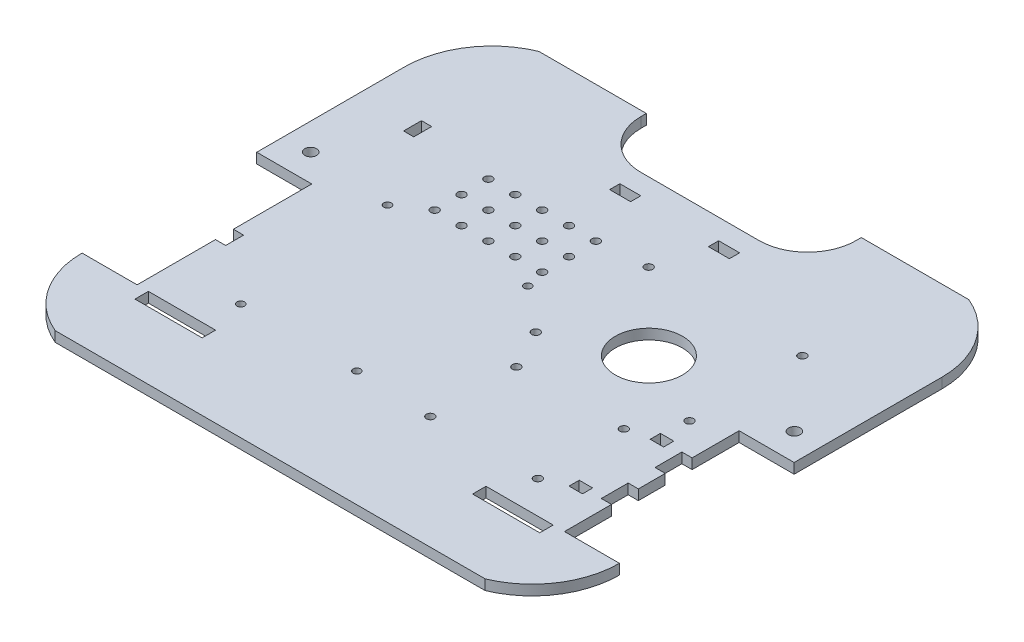
from build123d import *

# Parameters (mm, degrees)
SKETCH1_W           = 254
SKETCH1_H           = 228.6
BOSS_EXTRUDE1_DEPTH = 4.826
SKETCH2_W           = 26.00000007
SKETCH2_H           = 82.55
CUT_EXTRUDE1_DEPTH  = 4.826
CUT_EXTRUDE3_DEPTH  = 4.826
SKETCH7_W           = 101.6
SKETCH7_H           = 25.4
CUT_EXTRUDE5_DEPTH  = 4.826
FILLET9_R           = 22.86
FILLET10_R          = 22.86
CUT_EXTRUDE6_DEPTH  = 4.826
SKETCH9_W           = 31.75
SKETCH9_H           = 6.35
CUT_EXTRUDE7_DEPTH  = 171.929167423
SKETCH11_W          = 9.906
SKETCH11_H          = 4.826
CUT_EXTRUDE8_DEPTH  = 171.929167423
SKETCH13_R          = 1.905
CUT_EXTRUDE10_DEPTH = 171.929167423
SKETCH14_R          = 1.778
CUT_EXTRUDE11_DEPTH = 171.929167423
SKETCH15_R          = 1.905
CUT_EXTRUDE12_DEPTH = 171.929167423
SKETCH16_R          = 1.905
CUT_EXTRUDE13_DEPTH = 171.929167423
SKETCH17_R          = 2.778125
CUT_EXTRUDE14_DEPTH = 171.929167423
SKETCH18_W          = 4.826
SKETCH18_H          = 12.7
CUT_EXTRUDE15_DEPTH = 171.929167423
SKETCH19_W          = 4.826
SKETCH19_H          = 8.466666666
CUT_EXTRUDE16_DEPTH = 171.929167423
SKETCH20_W          = 6.35
SKETCH20_H          = 4.826
CUT_EXTRUDE17_DEPTH = 4.826
SKETCH21_R          = 15.875
CUT_EXTRUDE18_DEPTH = 171.929167423


with BuildPart() as part:
    # Sketch1 → Boss-Extrude1 (new body)
    with BuildSketch(Plane(origin=(0, 0, 0), x_dir=(1, 0, 0), z_dir=(0, 1, 0))):
        Rectangle(SKETCH1_W, SKETCH1_H)
    extrude(amount=BOSS_EXTRUDE1_DEPTH)

    # Sketch2 → Cut-Extrude1 (cut)
    with BuildSketch(Plane(origin=(0, 4.826, 0), x_dir=(1, 0, 0), z_dir=(0, 1, 0))):
        with Locations((-113.999999965, -34.925)):
            Rectangle(SKETCH2_W, SKETCH2_H)
        with Locations((113.999999965, -34.925)):
            Rectangle(SKETCH2_W, SKETCH2_H)
    extrude(amount=-CUT_EXTRUDE1_DEPTH, mode=Mode.SUBTRACT)

    # Sketch4 → Cut-Extrude3 (cut)
    with BuildSketch(Plane(origin=(0, 4.826, 0), x_dir=(1, 0, 0), z_dir=(0, 1, 0))):
        with BuildLine():
            Line((-127, 76.2), (-127, 114.3))
            Line((-127, 114.3), (-101.6, 114.3))
            ThreePointArc((-101.6, 114.3), (-120.067875899, 99.095250599), (-127, 76.2))
        make_face()
        with BuildLine():
            Line((127, 76.2), (127, 114.3))
            Line((127, 114.3), (101.6, 114.3))
            ThreePointArc((101.6, 114.3), (120.067875899, 99.095250599), (127, 76.2))
        make_face()
    extrude(amount=-CUT_EXTRUDE3_DEPTH, mode=Mode.SUBTRACT)

    # Sketch7 → Cut-Extrude5 (cut)
    with BuildSketch(Plane(origin=(0, 4.826, 0), x_dir=(1, 0, 0), z_dir=(0, 1, 0))):
        with Locations((0, 101.6)):
            Rectangle(SKETCH7_W, SKETCH7_H)
    extrude(amount=-CUT_EXTRUDE5_DEPTH, mode=Mode.SUBTRACT)

    # Fillet9
    fillet9_edges = [part.edges().sort_by_distance(p)[0] for p in [
        (-50.8, 2.413, -88.9),
    ]]
    fillet(fillet9_edges, radius=FILLET9_R)

    # Fillet10
    fillet10_edges = [part.edges().sort_by_distance(p)[0] for p in [
        (50.8, 2.413, -88.9),
    ]]
    fillet(fillet10_edges, radius=FILLET10_R)

    # Sketch8 → Cut-Extrude6 (cut)
    with BuildSketch(Plane(origin=(0, 4.826, 0), x_dir=(1, 0, 0), z_dir=(0, 1, 0))):
        with BuildLine():
            Line((-127, -76.2), (-127, -114.3))
            Line((-127, -114.3), (-101.6, -114.3))
            ThreePointArc((-101.6, -114.3), (-120.067875899, -99.095250599), (-127, -76.2))
        make_face()
        with BuildLine():
            Line((127, -114.3), (101.6, -114.3))
            ThreePointArc((101.6, -114.3), (120.067875899, -99.095250599), (127, -76.2))
            Line((127, -76.2), (127, -114.3))
        make_face()
    extrude(amount=-CUT_EXTRUDE6_DEPTH, mode=Mode.SUBTRACT)

    # Sketch9 → Cut-Extrude7 (cut, through all)
    with BuildSketch(Plane.XZ):
        with Locations((-79.79099993, 79.375)):
            Rectangle(SKETCH9_W, SKETCH9_H)
        with Locations((79.79099993, 79.375)):
            Rectangle(SKETCH9_W, SKETCH9_H)
    extrude(amount=-CUT_EXTRUDE7_DEPTH, mode=Mode.SUBTRACT)

    # Sketch11 → Cut-Extrude8 (cut, through all)
    with BuildSketch(Plane(origin=(0, 4.826, 0), x_dir=(1, 0, 0), z_dir=(0, 1, 0))):
        with Locations((-23.345869789, 76.863822677)):
            Rectangle(SKETCH11_W, SKETCH11_H)
        with Locations((23.345869789, 76.863822677)):
            Rectangle(SKETCH11_W, SKETCH11_H)
    extrude(amount=-CUT_EXTRUDE8_DEPTH, mode=Mode.SUBTRACT)

    # Sketch13 → Cut-Extrude10 (cut, through all)
    with BuildSketch(Plane(origin=(0, 4.826, 0), x_dir=(1, 0, 0), z_dir=(0, 1, 0))):
        with Locations((-10.4749371, 24.715879034)):
            Circle(SKETCH13_R)
        with Locations((-23.1749371, 24.715879034)):
            Circle(SKETCH13_R)
        with Locations((-35.8749371, 24.715879034)):
            Circle(SKETCH13_R)
        with Locations((-48.5749371, 24.715879034)):
            Circle(SKETCH13_R)
        with Locations((-61.2749371, 24.715879034)):
            Circle(SKETCH13_R)
        with Locations((-23.1749371, 37.415879034)):
            Circle(SKETCH13_R)
        with Locations((-35.8749371, 37.415879034)):
            Circle(SKETCH13_R)
        with Locations((-48.5749371, 37.415879034)):
            Circle(SKETCH13_R)
        with Locations((-61.2749371, 37.415879034)):
            Circle(SKETCH13_R)
        with Locations((-23.1749371, 50.115879034)):
            Circle(SKETCH13_R)
        with Locations((-35.8749371, 50.115879034)):
            Circle(SKETCH13_R)
        with Locations((-48.5749371, 50.115879034)):
            Circle(SKETCH13_R)
        with Locations((-61.2749371, 50.115879034)):
            Circle(SKETCH13_R)
        with Locations((-10.4749371, 37.415879034)):
            Circle(SKETCH13_R)
        with Locations((-10.4749371, 50.115879034)):
            Circle(SKETCH13_R)
    extrude(amount=-CUT_EXTRUDE10_DEPTH, mode=Mode.SUBTRACT)

    # Sketch14 → Cut-Extrude11 (cut, through all)
    with BuildSketch(Plane(origin=(0, 4.826, 0), x_dir=(1, 0, 0), z_dir=(0, 1, 0))):
        with Locations((-68.6409371, -59.556843517)):
            Circle(SKETCH14_R)
        with Locations((-13.7769371, -59.556843517)):
            Circle(SKETCH14_R)
        with Locations((-74.4829371, 15.627156483)):
            Circle(SKETCH14_R)
        with Locations((-8.1889371, 15.627156483)):
            Circle(SKETCH14_R)
    extrude(amount=-CUT_EXTRUDE11_DEPTH, mode=Mode.SUBTRACT)

    # Sketch15 → Cut-Extrude12 (cut, through all)
    with BuildSketch(Plane(origin=(0, 4.826, 0), x_dir=(1, 0, 0), z_dir=(0, 1, 0))):
        with Locations((22.218290503, -60.795548144)):
            Circle(SKETCH15_R)
        with Locations((22.218290503, -20.155548144)):
            Circle(SKETCH15_R)
        with Locations((73.018290503, -60.795548144)):
            Circle(SKETCH15_R)
        with Locations((73.018290503, -20.155548144)):
            Circle(SKETCH15_R)
    extrude(amount=-CUT_EXTRUDE12_DEPTH, mode=Mode.SUBTRACT)

    # Sketch16 → Cut-Extrude13 (cut, through all)
    with BuildSketch(Plane(origin=(0, 4.826, 0), x_dir=(1, 0, 0), z_dir=(0, 1, 0))):
        with Locations((85.253150773, -1.36459374)):
            Circle(SKETCH16_R)
        with Locations((12.609150773, -1.36459374)):
            Circle(SKETCH16_R)
        with Locations((12.609150773, 51.97540626)):
            Circle(SKETCH16_R)
        with Locations((85.253150773, 51.97540626)):
            Circle(SKETCH16_R)
    extrude(amount=-CUT_EXTRUDE13_DEPTH, mode=Mode.SUBTRACT)

    # Sketch17 → Cut-Extrude14 (cut, through all)
    with BuildSketch(Plane.XZ):
        with Locations((114.3, -19.164632523)):
            Circle(SKETCH17_R)
        with Locations((-114.3, -19.164632523)):
            Circle(SKETCH17_R)
    extrude(amount=-CUT_EXTRUDE14_DEPTH, mode=Mode.SUBTRACT)

    # Sketch18 → Cut-Extrude15 (cut, through all)
    with BuildSketch(Plane(origin=(0, 4.826, 0), x_dir=(1, 0, 0), z_dir=(0, 1, 0))):
        with Locations((98.58699993, -47.625)):
            Rectangle(SKETCH18_W, SKETCH18_H)
        with Locations((98.58699993, -22.225)):
            Rectangle(SKETCH18_W, SKETCH18_H)
    extrude(amount=-CUT_EXTRUDE15_DEPTH, mode=Mode.SUBTRACT)

    # Sketch19 → Cut-Extrude16 (cut, through all)
    with BuildSketch(Plane(origin=(0, 4.826, 0), x_dir=(1, 0, 0), z_dir=(0, 1, 0))):
        with Locations((-98.58699993, -34.925)):
            Rectangle(SKETCH19_W, SKETCH19_H)
        with Locations((-98.58699993, 53.975)):
            Rectangle(SKETCH19_W, SKETCH19_H)
    extrude(amount=-CUT_EXTRUDE16_DEPTH, mode=Mode.SUBTRACT)

    # Sketch20 → Cut-Extrude17 (cut)
    with BuildSketch(Plane.XZ):
        with Locations((86.64899993, 54.102)):
            Rectangle(SKETCH20_W, SKETCH20_H)
        with Locations((86.64899993, 15.748)):
            Rectangle(SKETCH20_W, SKETCH20_H)
    extrude(amount=-CUT_EXTRUDE17_DEPTH, mode=Mode.SUBTRACT)

    # Sketch21 → Cut-Extrude18 (cut, through all)
    with BuildSketch(Plane.XZ):
        with Locations((48.931150773, -15.778888076)):
            Circle(SKETCH21_R)
    extrude(amount=-CUT_EXTRUDE18_DEPTH, mode=Mode.SUBTRACT)


solid = part.part
